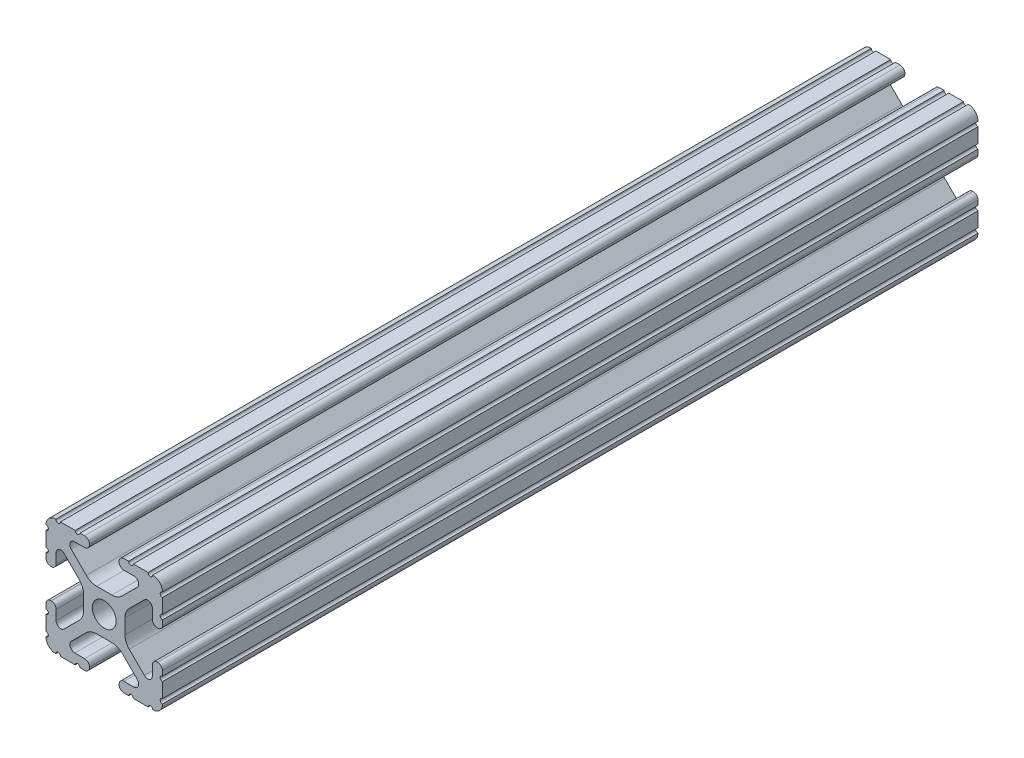
from build123d import *

# Parameters (mm, degrees)
SKETCH1_R               = 2.6035
BOSS_EXTRUDE1_DEPTH     = 88.9
CUT_EXTRUDE1_DEPTH      = 91.696141042
CUT_EXTRUDE1_DEPTH_BACK = 91.696141042
SKETCH2_R               = 3.175
CUT_EXTRUDE2_DEPTH      = 91.696141141
CUT_EXTRUDE2_DEPTH_BACK = 91.696141141
SKETCH3_R               = 3.175


with BuildPart() as part:
    # Sketch1 → Boss-Extrude1 (new, symmetric)
    with BuildSketch(Plane.XY):
        with BuildLine():
            Line((-7.179650497, -8.645192506), (-3.952270251, -5.423690499))
            ThreePointArc((-3.952270251, -5.423690499), (-2.922936451, -4.736929036), (-1.709253557, -4.4958))
            Line((-1.709253557, -4.4958), (1.709253557, -4.4958))
            ThreePointArc((1.709253557, -4.4958), (2.922936451, -4.736929036), (3.952270251, -5.423690499))
            Line((3.952270251, -5.423690499), (7.179650497, -8.645192506))
            ThreePointArc((7.179650497, -8.645192506), (7.41473083, -9.822813117), (6.416408329, -10.4902))
            Line((6.416408329, -10.4902), (4.287512407, -10.4902))
            ThreePointArc((4.287512407, -10.4902), (3.54574862, -10.79744862), (3.2385, -11.539212407))
            Line((3.2385, -11.539212407), (3.2385, -11.650987593))
            ThreePointArc((3.2385, -11.650987593), (3.54574862, -12.39275138), (4.287512407, -12.7))
            Line((4.287512407, -12.7), (5.317126718, -12.7))
            ThreePointArc((5.317126718, -12.7), (5.825126718, -12.192), (6.333126718, -12.7))
            Line((6.333126718, -12.7), (9.550443118, -12.7))
            ThreePointArc((9.550443118, -12.7), (10.058366869, -12.192000006), (10.566443095, -12.699847501))
            ThreePointArc((10.566443095, -12.699847501), (12.082537762, -12.08250727), (12.699846982, -10.566399977))
            ThreePointArc((12.699846982, -10.566399977), (12.192000006, -10.058323491), (12.7, -9.5504))
            Line((12.7, -9.5504), (12.7, -6.3330836))
            ThreePointArc((12.7, -6.3330836), (12.192, -5.8250836), (12.7, -5.3170836))
            Line((12.7, -5.3170836), (12.7, -4.287469289))
            ThreePointArc((12.7, -4.287469289), (12.39275138, -3.545705502), (11.650987593, -3.238456882))
            Line((11.650987593, -3.238456882), (11.539212407, -3.238456882))
            ThreePointArc((11.539212407, -3.238456882), (10.79744862, -3.545705502), (10.4902, -4.287469289))
            Line((10.4902, -4.287469289), (10.4902, -6.402089023))
            ThreePointArc((10.4902, -6.402089023), (9.856505071, -7.351067942), (8.737131347, -7.129408934))
            Line((8.737131347, -7.129408934), (5.441005833, -3.840816462))
            ThreePointArc((5.441005833, -3.840816462), (4.750877967, -2.809883091), (4.5085, -1.593185507))
            Line((4.5085, -1.593185507), (4.5085, 1.593185507))
            ThreePointArc((4.5085, 1.593185507), (4.750877967, 2.809883091), (5.441005833, 3.840816462))
            Line((5.441005833, 3.840816462), (8.737131347, 7.129408934))
            ThreePointArc((8.737131347, 7.129408934), (9.856505071, 7.351067942), (10.4902, 6.402089023))
            Line((10.4902, 6.402089023), (10.4902, 4.287469289))
            ThreePointArc((10.4902, 4.287469289), (10.79744862, 3.545705502), (11.539212407, 3.238456882))
            Line((11.539212407, 3.238456882), (11.650987593, 3.238456882))
            ThreePointArc((11.650987593, 3.238456882), (12.39275138, 3.545705502), (12.7, 4.287469289))
            Line((12.7, 4.287469289), (12.7, 5.3170836))
            ThreePointArc((12.7, 5.3170836), (12.192, 5.8250836), (12.7, 6.3330836))
            Line((12.7, 6.3330836), (12.7, 9.5504))
            ThreePointArc((12.7, 9.5504), (12.192000006, 10.058323491), (12.699846982, 10.566399977))
            ThreePointArc((12.699846982, 10.566399977), (12.082537762, 12.08250727), (10.566443095, 12.699847501))
            ThreePointArc((10.566443095, 12.699847501), (10.058366869, 12.192000006), (9.550443118, 12.7))
            Line((9.550443118, 12.7), (6.333126718, 12.7))
            ThreePointArc((6.333126718, 12.7), (5.825126718, 12.192), (5.317126718, 12.7))
            Line((5.317126718, 12.7), (4.287512407, 12.7))
            ThreePointArc((4.287512407, 12.7), (3.54574862, 12.39275138), (3.2385, 11.650987593))
            Line((3.2385, 11.650987593), (3.2385, 11.539212407))
            ThreePointArc((3.2385, 11.539212407), (3.54574862, 10.79744862), (4.287512407, 10.4902))
            Line((4.287512407, 10.4902), (6.476788598, 10.4902))
            ThreePointArc((6.476788598, 10.4902), (7.432222385, 9.85140422), (7.207036008, 8.724370562))
            Line((7.207036008, 8.724370562), (3.898272566, 5.423169045))
            ThreePointArc((3.898272566, 5.423169045), (2.869120213, 4.736787962), (1.655778399, 4.4958))
            Line((1.655778399, 4.4958), (-1.655778399, 4.4958))
            ThreePointArc((-1.655778399, 4.4958), (-2.869120213, 4.736787962), (-3.898272566, 5.423169045))
            Line((-3.898272566, 5.423169045), (-7.207036008, 8.724370562))
            ThreePointArc((-7.207036008, 8.724370562), (-7.432222385, 9.85140422), (-6.476788598, 10.4902))
            Line((-6.476788598, 10.4902), (-4.287512407, 10.4902))
            ThreePointArc((-4.287512407, 10.4902), (-3.54574862, 10.79744862), (-3.2385, 11.539212407))
            Line((-3.2385, 11.539212407), (-3.2385, 11.650987593))
            ThreePointArc((-3.2385, 11.650987593), (-3.54574862, 12.39275138), (-4.287512407, 12.7))
            Line((-4.287512407, 12.7), (-5.317126718, 12.7))
            ThreePointArc((-5.317126718, 12.7), (-5.825126718, 12.192), (-6.333126718, 12.7))
            Line((-6.333126718, 12.7), (-9.550443118, 12.7))
            ThreePointArc((-9.550443118, 12.7), (-10.058366869, 12.192000006), (-10.566443095, 12.699847501))
            ThreePointArc((-10.566443095, 12.699847501), (-12.082537762, 12.08250727), (-12.699846982, 10.566399977))
            ThreePointArc((-12.699846982, 10.566399977), (-12.192000006, 10.058323491), (-12.7, 9.5504))
            Line((-12.7, 9.5504), (-12.7, 6.3330836))
            ThreePointArc((-12.7, 6.3330836), (-12.192, 5.8250836), (-12.7, 5.3170836))
            Line((-12.7, 5.3170836), (-12.7, 4.287469289))
            ThreePointArc((-12.7, 4.287469289), (-12.39275138, 3.545705502), (-11.650987593, 3.238456882))
            Line((-11.650987593, 3.238456882), (-11.539212407, 3.238456882))
            ThreePointArc((-11.539212407, 3.238456882), (-10.79744862, 3.545705502), (-10.4902, 4.287469289))
            Line((-10.4902, 4.287469289), (-10.4902, 6.402089023))
            ThreePointArc((-10.4902, 6.402089023), (-9.856505071, 7.351067942), (-8.737131347, 7.129408934))
            Line((-8.737131347, 7.129408934), (-5.441005833, 3.840816462))
            ThreePointArc((-5.441005833, 3.840816462), (-4.750877967, 2.809883091), (-4.5085, 1.593185507))
            Line((-4.5085, 1.593185507), (-4.5085, -1.593185507))
            ThreePointArc((-4.5085, -1.593185507), (-4.750877967, -2.809883091), (-5.441005833, -3.840816462))
            Line((-5.441005833, -3.840816462), (-8.737131347, -7.129408934))
            ThreePointArc((-8.737131347, -7.129408934), (-9.856505071, -7.351067942), (-10.4902, -6.402089023))
            Line((-10.4902, -6.402089023), (-10.4902, -4.287469289))
            ThreePointArc((-10.4902, -4.287469289), (-10.79744862, -3.545705502), (-11.539212407, -3.238456882))
            Line((-11.539212407, -3.238456882), (-11.650987593, -3.238456882))
            ThreePointArc((-11.650987593, -3.238456882), (-12.39275138, -3.545705502), (-12.7, -4.287469289))
            Line((-12.7, -4.287469289), (-12.7, -5.3170836))
            ThreePointArc((-12.7, -5.3170836), (-12.192, -5.8250836), (-12.7, -6.3330836))
            Line((-12.7, -6.3330836), (-12.7, -9.5504))
            ThreePointArc((-12.7, -9.5504), (-12.192000006, -10.058323491), (-12.699846982, -10.566399977))
            ThreePointArc((-12.699846982, -10.566399977), (-12.082537762, -12.08250727), (-10.566443095, -12.699847501))
            ThreePointArc((-10.566443095, -12.699847501), (-10.058366869, -12.192000006), (-9.550443118, -12.7))
            Line((-9.550443118, -12.7), (-6.333126718, -12.7))
            ThreePointArc((-6.333126718, -12.7), (-5.825126718, -12.192), (-5.317126718, -12.7))
            Line((-5.317126718, -12.7), (-4.287512407, -12.7))
            ThreePointArc((-4.287512407, -12.7), (-3.54574862, -12.39275138), (-3.2385, -11.650987593))
            Line((-3.2385, -11.650987593), (-3.2385, -11.539212407))
            ThreePointArc((-3.2385, -11.539212407), (-3.54574862, -10.79744862), (-4.287512407, -10.4902))
            Line((-4.287512407, -10.4902), (-6.416408329, -10.4902))
            ThreePointArc((-6.416408329, -10.4902), (-7.41473083, -9.822813117), (-7.179650497, -8.645192506))
        make_face()
        Circle(SKETCH1_R, mode=Mode.SUBTRACT)
    extrude(amount=BOSS_EXTRUDE1_DEPTH, both=True)

    # Sketch2 → Cut-Extrude1 (cut, two sides: drawn at the far end of the back side and taken through both)
    with BuildSketch(Plane(origin=(0, 0, 0), x_dir=(0, 0, -1), z_dir=(1, 0, 0)).offset(-CUT_EXTRUDE1_DEPTH_BACK)):
        with Locations((-50.8, 0)):
            Circle(SKETCH2_R)
        with Locations((-76.2, 0)):
            Circle(SKETCH2_R)
    extrude(amount=CUT_EXTRUDE1_DEPTH + CUT_EXTRUDE1_DEPTH_BACK, mode=Mode.SUBTRACT)

    # Sketch3 → Cut-Extrude2 (cut, two sides: drawn at the far end of the back side and taken through both)
    with BuildSketch(Plane(origin=(0, 0, 0), x_dir=(1, 0, 0), z_dir=(0, 1, 0)).offset(-CUT_EXTRUDE2_DEPTH_BACK)):
        with Locations((0, 76.2)):
            Circle(SKETCH3_R)
        with Locations((0, -25.4)):
            Circle(SKETCH3_R)
    extrude(amount=CUT_EXTRUDE2_DEPTH + CUT_EXTRUDE2_DEPTH_BACK, mode=Mode.SUBTRACT)


solid = part.part
